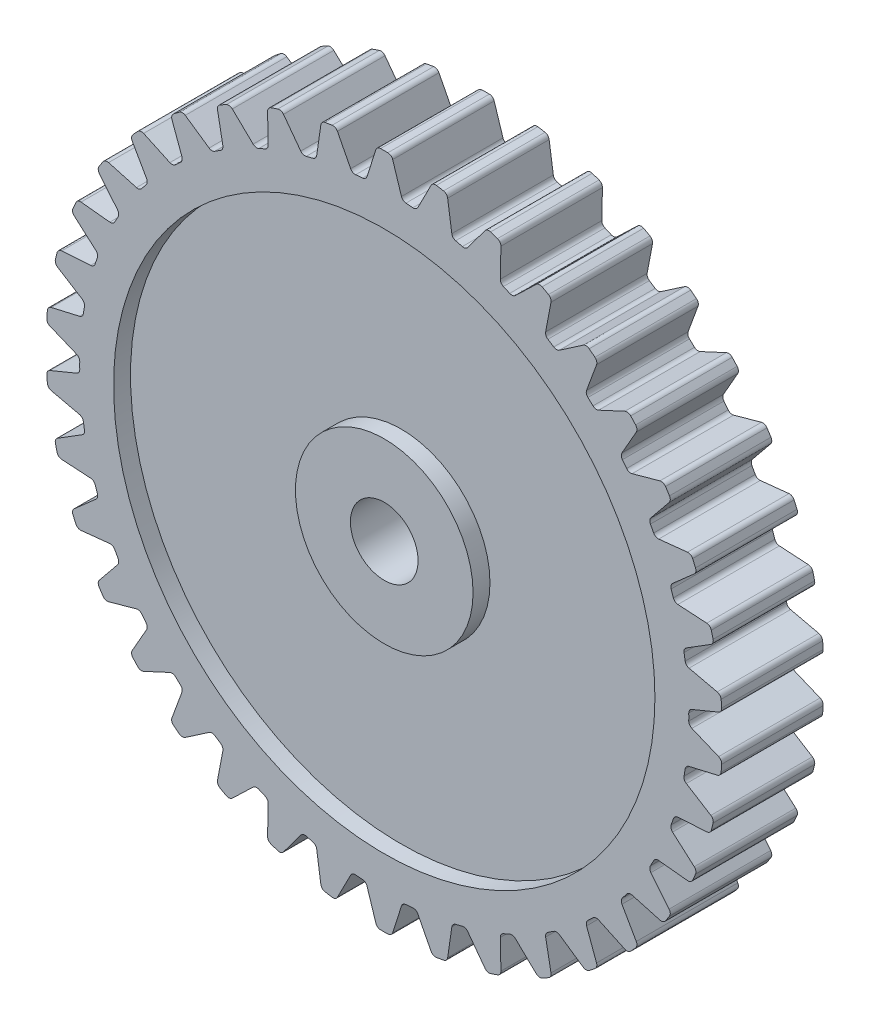
from build123d import *

# Parameters (mm, degrees)
SKETCH1_R           = 18
BODY_DEPTH          = 6
TOOTH_DEPTH         = 6
TOOTH_FILLET_R      = 0.3
TOOTH_START         = -6
TOOTH_PATTERN_DEPTH = 6
SKETCH3_R           = 16
SKETCH3_R_2         = 5.25
RESSES1_DEPTH       = 1
RESSES2_START       = -1
SKETCH4_R           = 16
SKETCH4_R_2         = 5.25
RESSES2_DEPTH       = 1
SKETCH5_R           = 5
BRASS_BOSS_DEPTH    = 5.7
SKETCH6_R           = 2
BORE_DEPTH          = 31.575410661
SKETCH7_R           = 1
GRUB_SCREW_DEPTH    = 31.575410661


# Read off the part's stored shape, not the designer's step: Tooth Pattern
with BuildPart() as part:
    # Sketch1 → Body (new body)
    with BuildSketch(Plane.XY):
        Circle(SKETCH1_R)
    extrude(amount=-BODY_DEPTH)

    # Sketch2 → Tooth (add)
    with BuildSketch(Plane.XY):
        with BuildLine():
            Line((-0.755, 18.984993416), (-1.080146971, 17.967561953))
            ThreePointArc((-1.080146971, 17.967561953), (0, 18), (1.080146971, 17.967561953))
            Line((1.080146971, 17.967561953), (0.755, 18.984993416))
            Line((0.755, 18.984993416), (0.432119981, 19.995331263))
            ThreePointArc((0.432119981, 19.995331263), (0, 20), (-0.432119981, 19.995331263))
            Line((-0.432119981, 19.995331263), (-0.755, 18.984993416))
        make_face()
    extrude(amount=-TOOTH_DEPTH)

    # Tooth Fillet
    tooth_fillet_edges = [part.edges().sort_by_distance(p)[0] for p in [
        (1.080146971, 17.967561953, -3),
        (-1.080146971, 17.967561953, -3),
        (-0.432119981, 19.995331263, -3),
        (0.432119981, 19.995331263, -3),
    ]]
    fillet(tooth_fillet_edges, radius=TOOTH_FILLET_R)

    # Tooth Pattern outline → Tooth Pattern (add)
    with BuildSketch(Plane.XY.offset(TOOTH_START)):
        with BuildLine():
            ThreePointArc((-2.766464282, 19.60218623), (-2.897226003, 19.73243964), (-3.079490328, 19.761496384))
            ThreePointArc((-3.079490328, 19.761496384), (-3.291891805, 19.727226068), (-3.503912338, 19.690672876))
            ThreePointArc((-3.503912338, 19.690672876), (-3.66686637, 19.604009378), (-3.748249848, 19.438355196))
            Line((-3.748249848, 19.438355196), (-3.993464858, 17.746921107))
            ThreePointArc((-3.993464858, 17.746921107), (-4.068630362, 17.587885563), (-4.220027265, 17.498324774))
            ThreePointArc((-4.220027265, 17.498324774), (-2.962702625, 17.754503462), (-1.690322218, 17.920457885))
            ThreePointArc((-1.690322218, 17.920457885), (-1.86259636, 17.956007529), (-1.985327947, 18.08201989))
            Line((-1.985327947, 18.08201989), (-2.766464282, 19.60218623))
        make_face()
        with BuildLine():
            ThreePointArc((1.690322218, 17.920457885), (2.962702625, 17.754503462), (4.220027265, 17.498324774))
            ThreePointArc((4.220027265, 17.498324774), (4.068630362, 17.587885563), (3.993464858, 17.746921107))
            Line((3.993464858, 17.746921107), (3.748249848, 19.438355196))
            ThreePointArc((3.748249848, 19.438355196), (3.66686637, 19.604009378), (3.503912338, 19.690672876))
            ThreePointArc((3.503912338, 19.690672876), (3.291891805, 19.727226068), (3.079490328, 19.761496384))
            ThreePointArc((3.079490328, 19.761496384), (2.897226003, 19.73243964), (2.766464282, 19.60218623))
            Line((2.766464282, 19.60218623), (1.985327947, 18.08201989))
            ThreePointArc((1.985327947, 18.08201989), (1.86259636, 17.956007529), (1.690322218, 17.920457885))
        make_face()
        with BuildLine():
            ThreePointArc((4.616878849, 17.397828304), (5.844590446, 17.024710351), (7.042601191, 16.565076772))
            ThreePointArc((7.042601191, 16.565076772), (6.908010365, 16.678335181), (6.860046411, 16.847573523))
            Line((6.860046411, 16.847573523), (6.896576715, 18.556299719))
            ThreePointArc((6.896576715, 18.556299719), (6.843568984, 18.733089874), (6.697101775, 18.845392748))
            ThreePointArc((6.697101775, 18.845392748), (6.493989384, 18.916344834), (6.290125495, 18.985107881))
            ThreePointArc((6.290125495, 18.985107881), (6.105564435, 18.986447156), (5.955147126, 18.879492905))
            Line((5.955147126, 18.879492905), (4.934453317, 17.508630467))
            ThreePointArc((4.934453317, 17.508630467), (4.792654676, 17.404537706), (4.616878849, 17.397828304))
        make_face()
        with BuildLine():
            ThreePointArc((7.417499061, 16.40063132), (8.567053075, 15.830527522), (9.673071314, 15.179976659))
            ThreePointArc((9.673071314, 15.179976659), (9.558957853, 15.313843292), (9.53950378, 15.488668051))
            Line((9.53950378, 15.488668051), (9.856782947, 17.168076758))
            ThreePointArc((9.856782947, 17.168076758), (9.833596875, 17.351180512), (9.707611734, 17.486059431))
            ThreePointArc((9.707611734, 17.486059431), (9.518947861, 17.589475024), (9.329182435, 17.690855126))
            ThreePointArc((9.329182435, 17.690855126), (9.147358984, 17.722553887), (8.98138908, 17.641816228))
            Line((8.98138908, 17.641816228), (7.748979663, 16.457651246))
            ThreePointArc((7.748979663, 16.457651246), (7.591981866, 16.378317464), (7.417499061, 16.40063132))
        make_face()
        with BuildLine():
            ThreePointArc((10.015789234, 14.956067866), (11.055828829, 14.204529169), (12.039685268, 13.380806353))
            ThreePointArc((12.039685268, 13.380806353), (11.949161889, 13.531629678), (11.958748354, 13.707272091))
            Line((11.958748354, 13.707272091), (12.548121835, 15.311553417))
            ThreePointArc((12.548121835, 15.311553417), (12.555389879, 15.495976177), (12.453323351, 15.649751996))
            ThreePointArc((12.453323351, 15.649751996), (12.284254254, 15.782810188), (12.113763597, 15.91404196))
            ThreePointArc((12.113763597, 15.91404196), (11.939637426, 15.975235548), (11.762642153, 15.922916793))
            Line((11.762642153, 15.922916793), (10.352134044, 14.957750202))
            ThreePointArc((10.352134044, 14.957750202), (10.184219581, 14.905339417), (10.015789234, 14.956067866))
        make_face()
        with BuildLine():
            ThreePointArc((12.340874786, 13.103541869), (13.243030392, 12.19106829), (14.077887993, 11.216642531))
            ThreePointArc((14.077887993, 11.216642531), (14.013423938, 11.380308481), (14.051789447, 11.55197748))
            Line((14.051789447, 11.55197748), (14.89718067, 13.037370814))
            ThreePointArc((14.89718067, 13.037370814), (14.934704575, 13.218082006), (14.85934077, 13.386560122))
            ThreePointArc((14.85934077, 13.386560122), (14.714478214, 13.545631432), (14.567912867, 13.703135214))
            ThreePointArc((14.567912867, 13.703135214), (14.406233684, 13.792154427), (14.223041012, 13.769681696))
            Line((14.223041012, 13.769681696), (12.672909195, 13.049840723))
            ThreePointArc((12.672909195, 13.049840723), (12.498658334, 13.025782565), (12.340874786, 13.103541869))
        make_face()
        with BuildLine():
            ThreePointArc((14.329333444, 10.893585408), (15.068996609, 9.845066847), (15.732082631, 8.746517941))
            ThreePointArc((15.732082631, 8.746517941), (15.695436313, 8.918562135), (15.761534355, 9.081575037))
            Line((15.761534355, 9.081575037), (16.83988325, 10.40756272))
            ThreePointArc((16.83988325, 10.40756272), (16.906639463, 10.579633016), (16.860034108, 10.758217784))
            ThreePointArc((16.860034108, 10.758217784), (16.743329565, 10.938963162), (16.62468745, 11.118442661))
            ThreePointArc((16.62468745, 11.118442661), (16.47986544, 11.232859286), (16.295472388, 11.240845578))
            Line((16.295472388, 11.240845578), (14.648000419, 10.785965608))
            ThreePointArc((14.648000419, 10.785965608), (14.47216627, 10.790916321), (14.329333444, 10.893585408))
        make_face()
        with BuildLine():
            ThreePointArc((15.92692524, 8.386480334), (16.48391988, 7.230517644), (16.957147066, 6.037811141))
            ThreePointArc((16.957147066, 6.037811141), (16.949318099, 6.213540663), (17.041345692, 6.363450901))
            Line((17.041345692, 6.363450901), (18.323237713, 7.493863446))
            ThreePointArc((18.323237713, 7.493863446), (18.417405298, 7.652599216), (18.400829666, 7.83641931))
            ThreePointArc((18.400829666, 7.83641931), (18.315466533, 8.033908493), (18.227983896, 8.230467976))
            ThreePointArc((18.227983896, 8.230467976), (18.103969427, 8.367161027), (17.923405756, 8.405388494))
            Line((17.923405756, 8.405388494), (16.223532375, 8.227877469))
            ThreePointArc((16.223532375, 8.227877469), (16.050911236, 8.26170201), (15.92692524, 8.386480334))
        make_face()
        with BuildLine():
            ThreePointArc((17.090072034, 5.650613939), (17.449204787, 4.418738768), (17.719664733, 3.164408593))
            ThreePointArc((17.719664733, 3.164408593), (17.740866672, 3.339029998), (17.856313542, 3.471748413))
            Line((17.856313542, 3.471748413), (19.306782017, 4.375751112))
            ThreePointArc((19.306782017, 4.375751112), (19.425792328, 4.516822458), (19.439698559, 4.700863745))
            ThreePointArc((19.439698559, 4.700863745), (19.388005319, 4.909709743), (19.334068458, 5.117987579))
            ThreePointArc((19.334068458, 5.117987579), (19.234244322, 5.273228426), (19.062435338, 5.340654324))
            Line((19.062435338, 5.340654324), (17.35652866, 5.44535428))
            ThreePointArc((17.35652866, 5.44535428), (17.191829184, 5.507130004), (17.090072034, 5.650613939))
        make_face()
        with BuildLine():
            ThreePointArc((17.787046213, 2.760613526), (17.938520874, 1.486428219), (17.998836138, 0.204689228))
            ThreePointArc((17.998836138, 0.204689228), (18.048490649, 0.3734393), (18.184207707, 0.485345678))
            Line((18.184207707, 0.485345678), (19.763687636, 1.138279695))
            ThreePointArc((19.763687636, 1.138279695), (19.904294382, 1.257838557), (19.94830315, 1.437080871))
            ThreePointArc((19.94830315, 1.437080871), (19.93168986, 1.65158691), (19.912770033, 1.865901823))
            ThreePointArc((19.912770033, 1.865901823), (19.839859172, 2.0354559), (19.681491377, 2.130241026))
            Line((19.681491377, 2.130241026), (18.016084088, 2.514296021))
            ThreePointArc((18.016084088, 2.514296021), (17.863798849, 2.602337848), (17.787046213, 2.760613526))
        make_face()
        with BuildLine():
            ThreePointArc((17.998836138, -0.204689228), (17.938520874, -1.486428219), (17.787046212, -2.760613526))
            ThreePointArc((17.787046212, -2.760613526), (17.863798849, -2.602337848), (18.016084088, -2.514296021))
            Line((18.016084088, -2.514296021), (19.681491377, -2.130241026))
            ThreePointArc((19.681491377, -2.130241026), (19.839859172, -2.0354559), (19.912770033, -1.865901823))
            ThreePointArc((19.912770033, -1.865901823), (19.93168986, -1.65158691), (19.94830315, -1.437080871))
            ThreePointArc((19.94830315, -1.437080871), (19.904294382, -1.257838557), (19.763687636, -1.138279695))
            Line((19.763687636, -1.138279695), (18.184207707, -0.485345678))
            ThreePointArc((18.184207707, -0.485345678), (18.048490649, -0.3734393), (17.998836138, -0.204689228))
        make_face()
        with BuildLine():
            ThreePointArc((17.719664733, -3.164408593), (17.449204787, -4.418738768), (17.090072034, -5.650613939))
            ThreePointArc((17.090072034, -5.650613939), (17.191829184, -5.507130004), (17.35652866, -5.44535428))
            Line((17.35652866, -5.44535428), (19.062435338, -5.340654324))
            ThreePointArc((19.062435338, -5.340654324), (19.234244322, -5.273228426), (19.334068458, -5.117987579))
            ThreePointArc((19.334068458, -5.117987579), (19.388005319, -4.909709743), (19.439698559, -4.700863745))
            ThreePointArc((19.439698559, -4.700863745), (19.425792328, -4.516822458), (19.306782017, -4.375751112))
            Line((19.306782017, -4.375751112), (17.856313542, -3.471748413))
            ThreePointArc((17.856313542, -3.471748413), (17.740866672, -3.339029998), (17.719664733, -3.164408593))
        make_face()
        with BuildLine():
            ThreePointArc((16.957147066, -6.037811141), (16.48391988, -7.230517644), (15.92692524, -8.386480334))
            ThreePointArc((15.92692524, -8.386480334), (16.050911236, -8.26170201), (16.223532375, -8.227877469))
            Line((16.223532375, -8.227877469), (17.923405756, -8.405388494))
            ThreePointArc((17.923405756, -8.405388494), (18.103969427, -8.367161027), (18.227983896, -8.230467976))
            ThreePointArc((18.227983896, -8.230467976), (18.315466533, -8.033908493), (18.400829666, -7.83641931))
            ThreePointArc((18.400829666, -7.83641931), (18.417405298, -7.652599216), (18.323237713, -7.493863446))
            Line((18.323237713, -7.493863446), (17.041345692, -6.363450901))
            ThreePointArc((17.041345692, -6.363450901), (16.949318099, -6.213540663), (16.957147066, -6.037811141))
        make_face()
        with BuildLine():
            ThreePointArc((15.732082631, -8.746517941), (15.068996609, -9.845066847), (14.329333444, -10.893585408))
            ThreePointArc((14.329333444, -10.893585408), (14.47216627, -10.790916321), (14.648000419, -10.785965608))
            Line((14.648000419, -10.785965608), (16.295472388, -11.240845578))
            ThreePointArc((16.295472388, -11.240845578), (16.47986544, -11.232859286), (16.62468745, -11.118442661))
            ThreePointArc((16.62468745, -11.118442661), (16.743329565, -10.938963162), (16.860034108, -10.758217784))
            ThreePointArc((16.860034108, -10.758217784), (16.906639463, -10.579633016), (16.83988325, -10.40756272))
            Line((16.83988325, -10.40756272), (15.761534355, -9.081575037))
            ThreePointArc((15.761534355, -9.081575037), (15.695436313, -8.918562135), (15.732082631, -8.746517941))
        make_face()
        with BuildLine():
            ThreePointArc((14.077887992, -11.216642531), (13.243030392, -12.191068289), (12.340874786, -13.103541869))
            ThreePointArc((12.340874786, -13.103541869), (12.498658334, -13.025782565), (12.672909195, -13.049840723))
            Line((12.672909195, -13.049840723), (14.223041012, -13.769681696))
            ThreePointArc((14.223041012, -13.769681696), (14.406233684, -13.792154427), (14.567912867, -13.703135214))
            ThreePointArc((14.567912867, -13.703135214), (14.714478214, -13.545631432), (14.85934077, -13.386560122))
            ThreePointArc((14.85934077, -13.386560122), (14.934704575, -13.218082006), (14.89718067, -13.037370814))
            Line((14.89718067, -13.037370814), (14.051789447, -11.55197748))
            ThreePointArc((14.051789447, -11.55197748), (14.013423938, -11.380308481), (14.077887992, -11.216642531))
        make_face()
        with BuildLine():
            ThreePointArc((12.039685268, -13.380806353), (11.055828829, -14.204529169), (10.015789234, -14.956067866))
            ThreePointArc((10.015789234, -14.956067866), (10.184219581, -14.905339417), (10.352134044, -14.957750202))
            Line((10.352134044, -14.957750202), (11.762642153, -15.922916793))
            ThreePointArc((11.762642153, -15.922916793), (11.939637426, -15.975235548), (12.113763597, -15.91404196))
            ThreePointArc((12.113763597, -15.91404196), (12.284254254, -15.782810188), (12.453323351, -15.649751996))
            ThreePointArc((12.453323351, -15.649751996), (12.555389879, -15.495976177), (12.548121835, -15.311553417))
            Line((12.548121835, -15.311553417), (11.958748354, -13.707272091))
            ThreePointArc((11.958748354, -13.707272091), (11.949161889, -13.531629678), (12.039685268, -13.380806353))
        make_face()
        with BuildLine():
            ThreePointArc((9.673071314, -15.179976659), (8.567053075, -15.830527522), (7.417499061, -16.40063132))
            ThreePointArc((7.417499061, -16.40063132), (7.591981866, -16.378317464), (7.748979663, -16.457651246))
            Line((7.748979663, -16.457651246), (8.98138908, -17.641816228))
            ThreePointArc((8.98138908, -17.641816228), (9.147358984, -17.722553887), (9.329182435, -17.690855126))
            ThreePointArc((9.329182435, -17.690855126), (9.518947861, -17.589475024), (9.707611734, -17.486059431))
            ThreePointArc((9.707611734, -17.486059431), (9.833596875, -17.351180512), (9.856782947, -17.168076758))
            Line((9.856782947, -17.168076758), (9.53950378, -15.488668051))
            ThreePointArc((9.53950378, -15.488668051), (9.558957853, -15.313843292), (9.673071314, -15.179976659))
        make_face()
        with BuildLine():
            ThreePointArc((7.042601191, -16.565076772), (5.844590446, -17.024710351), (4.616878849, -17.397828304))
            ThreePointArc((4.616878849, -17.397828304), (4.792654676, -17.404537706), (4.934453317, -17.508630467))
            Line((4.934453317, -17.508630467), (5.955147126, -18.879492905))
            ThreePointArc((5.955147126, -18.879492905), (6.105564435, -18.986447156), (6.290125495, -18.985107881))
            ThreePointArc((6.290125495, -18.985107881), (6.493989384, -18.916344834), (6.697101775, -18.845392748))
            ThreePointArc((6.697101775, -18.845392748), (6.843568984, -18.733089874), (6.896576715, -18.556299719))
            Line((6.896576715, -18.556299719), (6.860046411, -16.847573523))
            ThreePointArc((6.860046411, -16.847573523), (6.908010365, -16.678335181), (7.042601191, -16.565076772))
        make_face()
        with BuildLine():
            ThreePointArc((4.220027265, -17.498324774), (2.962702625, -17.754503461), (1.690322218, -17.920457885))
            ThreePointArc((1.690322218, -17.920457885), (1.86259636, -17.956007529), (1.985327947, -18.08201989))
            Line((1.985327947, -18.08201989), (2.766464282, -19.60218623))
            ThreePointArc((2.766464282, -19.60218623), (2.897226003, -19.73243964), (3.079490328, -19.761496384))
            ThreePointArc((3.079490328, -19.761496384), (3.291891805, -19.727226068), (3.503912338, -19.690672876))
            ThreePointArc((3.503912338, -19.690672876), (3.66686637, -19.604009378), (3.748249848, -19.438355196))
            Line((3.748249848, -19.438355196), (3.993464858, -17.746921107))
            ThreePointArc((3.993464858, -17.746921107), (4.068630362, -17.587885563), (4.220027265, -17.498324774))
        make_face()
        with BuildLine():
            ThreePointArc((1.282341997, -17.95426409), (0, -18), (-1.282341997, -17.95426409))
            ThreePointArc((-1.282341997, -17.95426409), (-1.118268729, -18.017684275), (-1.017951994, -18.162178947))
            Line((-1.017951994, -18.162178947), (-0.497680497, -19.790183015))
            ThreePointArc((-0.497680497, -19.790183015), (-0.390141201, -19.94018261), (-0.215145306, -19.998842779))
            ThreePointArc((-0.215145306, -19.998842779), (0, -20), (0.215145306, -19.998842779))
            ThreePointArc((0.215145306, -19.998842779), (0.390141201, -19.94018261), (0.497680497, -19.790183015))
            Line((0.497680497, -19.790183015), (1.017951994, -18.162178947))
            ThreePointArc((1.017951994, -18.162178947), (1.118268729, -18.017684275), (1.282341997, -17.95426409))
        make_face()
        with BuildLine():
            ThreePointArc((-1.690322218, -17.920457885), (-2.962702625, -17.754503461), (-4.220027265, -17.498324774))
            ThreePointArc((-4.220027265, -17.498324774), (-4.068630362, -17.587885563), (-3.993464858, -17.746921107))
            Line((-3.993464858, -17.746921107), (-3.748249848, -19.438355196))
            ThreePointArc((-3.748249848, -19.438355196), (-3.66686637, -19.604009378), (-3.503912338, -19.690672876))
            ThreePointArc((-3.503912338, -19.690672876), (-3.291891805, -19.727226068), (-3.079490328, -19.761496384))
            ThreePointArc((-3.079490328, -19.761496384), (-2.897226003, -19.73243964), (-2.766464282, -19.60218623))
            Line((-2.766464282, -19.60218623), (-1.985327947, -18.08201989))
            ThreePointArc((-1.985327947, -18.08201989), (-1.86259636, -17.956007529), (-1.690322218, -17.920457885))
        make_face()
        with BuildLine():
            ThreePointArc((-4.616878849, -17.397828304), (-5.844590446, -17.024710351), (-7.042601191, -16.565076772))
            ThreePointArc((-7.042601191, -16.565076772), (-6.908010365, -16.678335181), (-6.860046411, -16.847573523))
            Line((-6.860046411, -16.847573523), (-6.896576715, -18.556299719))
            ThreePointArc((-6.896576715, -18.556299719), (-6.843568984, -18.733089874), (-6.697101775, -18.845392748))
            ThreePointArc((-6.697101775, -18.845392748), (-6.493989384, -18.916344834), (-6.290125495, -18.985107881))
            ThreePointArc((-6.290125495, -18.985107881), (-6.105564435, -18.986447156), (-5.955147126, -18.879492905))
            Line((-5.955147126, -18.879492905), (-4.934453317, -17.508630467))
            ThreePointArc((-4.934453317, -17.508630467), (-4.792654676, -17.404537706), (-4.616878849, -17.397828304))
        make_face()
        with BuildLine():
            ThreePointArc((-7.417499061, -16.40063132), (-8.567053075, -15.830527522), (-9.673071314, -15.179976659))
            ThreePointArc((-9.673071314, -15.179976659), (-9.558957853, -15.313843292), (-9.53950378, -15.488668051))
            Line((-9.53950378, -15.488668051), (-9.856782947, -17.168076758))
            ThreePointArc((-9.856782947, -17.168076758), (-9.833596875, -17.351180512), (-9.707611734, -17.486059431))
            ThreePointArc((-9.707611734, -17.486059431), (-9.518947861, -17.589475024), (-9.329182435, -17.690855126))
            ThreePointArc((-9.329182435, -17.690855126), (-9.147358984, -17.722553887), (-8.98138908, -17.641816228))
            Line((-8.98138908, -17.641816228), (-7.748979663, -16.457651246))
            ThreePointArc((-7.748979663, -16.457651246), (-7.591981866, -16.378317464), (-7.417499061, -16.40063132))
        make_face()
        with BuildLine():
            ThreePointArc((-10.015789234, -14.956067866), (-11.055828829, -14.204529169), (-12.039685268, -13.380806353))
            ThreePointArc((-12.039685268, -13.380806353), (-11.949161889, -13.531629678), (-11.958748354, -13.707272091))
            Line((-11.958748354, -13.707272091), (-12.548121835, -15.311553417))
            ThreePointArc((-12.548121835, -15.311553417), (-12.555389879, -15.495976177), (-12.453323351, -15.649751996))
            ThreePointArc((-12.453323351, -15.649751996), (-12.284254254, -15.782810188), (-12.113763597, -15.91404196))
            ThreePointArc((-12.113763597, -15.91404196), (-11.939637426, -15.975235548), (-11.762642153, -15.922916793))
            Line((-11.762642153, -15.922916793), (-10.352134044, -14.957750202))
            ThreePointArc((-10.352134044, -14.957750202), (-10.184219581, -14.905339417), (-10.015789234, -14.956067866))
        make_face()
        with BuildLine():
            ThreePointArc((-12.340874786, -13.103541869), (-13.243030392, -12.191068289), (-14.077887992, -11.216642531))
            ThreePointArc((-14.077887992, -11.216642531), (-14.013423938, -11.380308481), (-14.051789447, -11.55197748))
            Line((-14.051789447, -11.55197748), (-14.89718067, -13.037370814))
            ThreePointArc((-14.89718067, -13.037370814), (-14.934704575, -13.218082006), (-14.85934077, -13.386560122))
            ThreePointArc((-14.85934077, -13.386560122), (-14.714478214, -13.545631432), (-14.567912867, -13.703135214))
            ThreePointArc((-14.567912867, -13.703135214), (-14.406233684, -13.792154427), (-14.223041012, -13.769681696))
            Line((-14.223041012, -13.769681696), (-12.672909195, -13.049840723))
            ThreePointArc((-12.672909195, -13.049840723), (-12.498658334, -13.025782565), (-12.340874786, -13.103541869))
        make_face()
        with BuildLine():
            ThreePointArc((-14.329333444, -10.893585408), (-15.068996609, -9.845066847), (-15.732082631, -8.746517941))
            ThreePointArc((-15.732082631, -8.746517941), (-15.695436313, -8.918562135), (-15.761534355, -9.081575037))
            Line((-15.761534355, -9.081575037), (-16.83988325, -10.40756272))
            ThreePointArc((-16.83988325, -10.40756272), (-16.906639463, -10.579633016), (-16.860034108, -10.758217784))
            ThreePointArc((-16.860034108, -10.758217784), (-16.743329565, -10.938963162), (-16.62468745, -11.118442661))
            ThreePointArc((-16.62468745, -11.118442661), (-16.47986544, -11.232859286), (-16.295472388, -11.240845578))
            Line((-16.295472388, -11.240845578), (-14.648000419, -10.785965608))
            ThreePointArc((-14.648000419, -10.785965608), (-14.47216627, -10.790916321), (-14.329333444, -10.893585408))
        make_face()
        with BuildLine():
            ThreePointArc((-15.92692524, -8.386480334), (-16.48391988, -7.230517644), (-16.957147066, -6.037811141))
            ThreePointArc((-16.957147066, -6.037811141), (-16.949318099, -6.213540663), (-17.041345692, -6.363450901))
            Line((-17.041345692, -6.363450901), (-18.323237713, -7.493863446))
            ThreePointArc((-18.323237713, -7.493863446), (-18.417405298, -7.652599216), (-18.400829666, -7.83641931))
            ThreePointArc((-18.400829666, -7.83641931), (-18.315466533, -8.033908493), (-18.227983896, -8.230467976))
            ThreePointArc((-18.227983896, -8.230467976), (-18.103969427, -8.367161027), (-17.923405756, -8.405388494))
            Line((-17.923405756, -8.405388494), (-16.223532375, -8.227877469))
            ThreePointArc((-16.223532375, -8.227877469), (-16.050911236, -8.26170201), (-15.92692524, -8.386480334))
        make_face()
        with BuildLine():
            ThreePointArc((-17.090072034, -5.650613939), (-17.449204787, -4.418738768), (-17.719664733, -3.164408593))
            ThreePointArc((-17.719664733, -3.164408593), (-17.740866672, -3.339029998), (-17.856313542, -3.471748413))
            Line((-17.856313542, -3.471748413), (-19.306782017, -4.375751112))
            ThreePointArc((-19.306782017, -4.375751112), (-19.425792328, -4.516822458), (-19.439698559, -4.700863745))
            ThreePointArc((-19.439698559, -4.700863745), (-19.388005319, -4.909709743), (-19.334068458, -5.117987579))
            ThreePointArc((-19.334068458, -5.117987579), (-19.234244322, -5.273228426), (-19.062435338, -5.340654324))
            Line((-19.062435338, -5.340654324), (-17.35652866, -5.44535428))
            ThreePointArc((-17.35652866, -5.44535428), (-17.191829184, -5.507130004), (-17.090072034, -5.650613939))
        make_face()
        with BuildLine():
            ThreePointArc((-17.787046212, -2.760613526), (-17.938520874, -1.486428219), (-17.998836138, -0.204689228))
            ThreePointArc((-17.998836138, -0.204689228), (-18.048490649, -0.3734393), (-18.184207707, -0.485345678))
            Line((-18.184207707, -0.485345678), (-19.763687636, -1.138279695))
            ThreePointArc((-19.763687636, -1.138279695), (-19.904294382, -1.257838557), (-19.94830315, -1.437080871))
            ThreePointArc((-19.94830315, -1.437080871), (-19.93168986, -1.65158691), (-19.912770033, -1.865901823))
            ThreePointArc((-19.912770033, -1.865901823), (-19.839859172, -2.0354559), (-19.681491377, -2.130241026))
            Line((-19.681491377, -2.130241026), (-18.016084088, -2.514296021))
            ThreePointArc((-18.016084088, -2.514296021), (-17.863798849, -2.602337848), (-17.787046212, -2.760613526))
        make_face()
        with BuildLine():
            ThreePointArc((-17.998836138, 0.204689228), (-17.938520874, 1.486428219), (-17.787046213, 2.760613526))
            ThreePointArc((-17.787046213, 2.760613526), (-17.863798849, 2.602337848), (-18.016084088, 2.514296021))
            Line((-18.016084088, 2.514296021), (-19.681491377, 2.130241026))
            ThreePointArc((-19.681491377, 2.130241026), (-19.839859172, 2.0354559), (-19.912770033, 1.865901823))
            ThreePointArc((-19.912770033, 1.865901823), (-19.93168986, 1.65158691), (-19.94830315, 1.437080871))
            ThreePointArc((-19.94830315, 1.437080871), (-19.904294382, 1.257838557), (-19.763687636, 1.138279695))
            Line((-19.763687636, 1.138279695), (-18.184207707, 0.485345678))
            ThreePointArc((-18.184207707, 0.485345678), (-18.048490649, 0.3734393), (-17.998836138, 0.204689228))
        make_face()
        with BuildLine():
            ThreePointArc((-17.719664733, 3.164408593), (-17.449204787, 4.418738768), (-17.090072034, 5.650613939))
            ThreePointArc((-17.090072034, 5.650613939), (-17.191829184, 5.507130004), (-17.35652866, 5.44535428))
            Line((-17.35652866, 5.44535428), (-19.062435338, 5.340654324))
            ThreePointArc((-19.062435338, 5.340654324), (-19.234244322, 5.273228426), (-19.334068458, 5.117987579))
            ThreePointArc((-19.334068458, 5.117987579), (-19.388005319, 4.909709743), (-19.439698559, 4.700863745))
            ThreePointArc((-19.439698559, 4.700863745), (-19.425792328, 4.516822458), (-19.306782017, 4.375751112))
            Line((-19.306782017, 4.375751112), (-17.856313542, 3.471748413))
            ThreePointArc((-17.856313542, 3.471748413), (-17.740866672, 3.339029998), (-17.719664733, 3.164408593))
        make_face()
        with BuildLine():
            ThreePointArc((-16.957147066, 6.037811141), (-16.48391988, 7.230517644), (-15.92692524, 8.386480334))
            ThreePointArc((-15.92692524, 8.386480334), (-16.050911236, 8.26170201), (-16.223532375, 8.227877469))
            Line((-16.223532375, 8.227877469), (-17.923405756, 8.405388494))
            ThreePointArc((-17.923405756, 8.405388494), (-18.103969427, 8.367161027), (-18.227983896, 8.230467976))
            ThreePointArc((-18.227983896, 8.230467976), (-18.315466533, 8.033908493), (-18.400829666, 7.83641931))
            ThreePointArc((-18.400829666, 7.83641931), (-18.417405298, 7.652599216), (-18.323237713, 7.493863446))
            Line((-18.323237713, 7.493863446), (-17.041345692, 6.363450901))
            ThreePointArc((-17.041345692, 6.363450901), (-16.949318099, 6.213540663), (-16.957147066, 6.037811141))
        make_face()
        with BuildLine():
            ThreePointArc((-15.732082631, 8.746517941), (-15.068996609, 9.845066847), (-14.329333444, 10.893585408))
            ThreePointArc((-14.329333444, 10.893585408), (-14.47216627, 10.790916321), (-14.648000419, 10.785965608))
            Line((-14.648000419, 10.785965608), (-16.295472388, 11.240845578))
            ThreePointArc((-16.295472388, 11.240845578), (-16.47986544, 11.232859286), (-16.62468745, 11.118442661))
            ThreePointArc((-16.62468745, 11.118442661), (-16.743329565, 10.938963162), (-16.860034108, 10.758217784))
            ThreePointArc((-16.860034108, 10.758217784), (-16.906639463, 10.579633016), (-16.83988325, 10.40756272))
            Line((-16.83988325, 10.40756272), (-15.761534355, 9.081575037))
            ThreePointArc((-15.761534355, 9.081575037), (-15.695436313, 8.918562135), (-15.732082631, 8.746517941))
        make_face()
        with BuildLine():
            ThreePointArc((-14.077887993, 11.216642531), (-13.243030392, 12.19106829), (-12.340874786, 13.103541869))
            ThreePointArc((-12.340874786, 13.103541869), (-12.498658334, 13.025782565), (-12.672909195, 13.049840723))
            Line((-12.672909195, 13.049840723), (-14.223041012, 13.769681696))
            ThreePointArc((-14.223041012, 13.769681696), (-14.406233684, 13.792154427), (-14.567912867, 13.703135214))
            ThreePointArc((-14.567912867, 13.703135214), (-14.714478214, 13.545631432), (-14.85934077, 13.386560122))
            ThreePointArc((-14.85934077, 13.386560122), (-14.934704575, 13.218082006), (-14.89718067, 13.037370814))
            Line((-14.89718067, 13.037370814), (-14.051789447, 11.55197748))
            ThreePointArc((-14.051789447, 11.55197748), (-14.013423938, 11.380308481), (-14.077887993, 11.216642531))
        make_face()
        with BuildLine():
            ThreePointArc((-12.039685268, 13.380806353), (-11.055828829, 14.204529169), (-10.015789234, 14.956067866))
            ThreePointArc((-10.015789234, 14.956067866), (-10.184219581, 14.905339417), (-10.352134044, 14.957750202))
            Line((-10.352134044, 14.957750202), (-11.762642153, 15.922916793))
            ThreePointArc((-11.762642153, 15.922916793), (-11.939637426, 15.975235548), (-12.113763597, 15.91404196))
            ThreePointArc((-12.113763597, 15.91404196), (-12.284254254, 15.782810188), (-12.453323351, 15.649751996))
            ThreePointArc((-12.453323351, 15.649751996), (-12.555389879, 15.495976177), (-12.548121835, 15.311553417))
            Line((-12.548121835, 15.311553417), (-11.958748354, 13.707272091))
            ThreePointArc((-11.958748354, 13.707272091), (-11.949161889, 13.531629678), (-12.039685268, 13.380806353))
        make_face()
        with BuildLine():
            ThreePointArc((-9.673071314, 15.179976659), (-8.567053075, 15.830527522), (-7.417499061, 16.40063132))
            ThreePointArc((-7.417499061, 16.40063132), (-7.591981866, 16.378317464), (-7.748979663, 16.457651246))
            Line((-7.748979663, 16.457651246), (-8.98138908, 17.641816228))
            ThreePointArc((-8.98138908, 17.641816228), (-9.147358984, 17.722553887), (-9.329182435, 17.690855126))
            ThreePointArc((-9.329182435, 17.690855126), (-9.518947861, 17.589475024), (-9.707611734, 17.486059431))
            ThreePointArc((-9.707611734, 17.486059431), (-9.833596875, 17.351180512), (-9.856782947, 17.168076758))
            Line((-9.856782947, 17.168076758), (-9.53950378, 15.488668051))
            ThreePointArc((-9.53950378, 15.488668051), (-9.558957853, 15.313843292), (-9.673071314, 15.179976659))
        make_face()
        with BuildLine():
            ThreePointArc((-7.042601191, 16.565076772), (-5.844590446, 17.024710351), (-4.616878849, 17.397828304))
            ThreePointArc((-4.616878849, 17.397828304), (-4.792654676, 17.404537706), (-4.934453317, 17.508630467))
            Line((-4.934453317, 17.508630467), (-5.955147126, 18.879492905))
            ThreePointArc((-5.955147126, 18.879492905), (-6.105564435, 18.986447156), (-6.290125495, 18.985107881))
            ThreePointArc((-6.290125495, 18.985107881), (-6.493989384, 18.916344834), (-6.697101775, 18.845392748))
            ThreePointArc((-6.697101775, 18.845392748), (-6.843568984, 18.733089874), (-6.896576715, 18.556299719))
            Line((-6.896576715, 18.556299719), (-6.860046411, 16.847573523))
            ThreePointArc((-6.860046411, 16.847573523), (-6.908010365, 16.678335181), (-7.042601191, 16.565076772))
        make_face()
    extrude(amount=TOOTH_PATTERN_DEPTH)

    # Sketch3 → Resses1 (cut)
    with BuildSketch(Plane.XY):
        Circle(SKETCH3_R)
        Circle(SKETCH3_R_2, mode=Mode.SUBTRACT)
    extrude(amount=-RESSES1_DEPTH, mode=Mode.SUBTRACT)

    # Sketch4 → Resses2 (cut)
    with BuildSketch(Plane(origin=(0, 0, -6), x_dir=(-1, 0, 0), z_dir=(0, 0, -1)).offset(RESSES2_START)):
        with Locations(Location((0, 0, 0), (0, 0, 180))):
            Circle(SKETCH4_R)
        with Locations(Location((0, 0, 0), (0, 0, 180))):
            Circle(SKETCH4_R_2, mode=Mode.SUBTRACT)
    extrude(amount=RESSES2_DEPTH, mode=Mode.SUBTRACT)

    # Sketch5 → Brass boss (add)
    with BuildSketch(Plane(origin=(0, 0, -6), x_dir=(-1, 0, 0), z_dir=(0, 0, -1))):
        with Locations(Location((0, 0, 0), (0, 0, 180))):
            Circle(SKETCH5_R)
    extrude(amount=BRASS_BOSS_DEPTH)

    # Sketch6 → Bore (cut, through all)
    with BuildSketch(Plane(origin=(0, 0, -11.7), x_dir=(-1, 0, 0), z_dir=(0, 0, -1))):
        Circle(SKETCH6_R)
    extrude(amount=-BORE_DEPTH, mode=Mode.SUBTRACT)

    # Sketch7 → Grub screw (cut, through all)
    with BuildSketch(Plane(origin=(0, 0, 0), x_dir=(1, 0, 0), z_dir=(0, 1, 0))):
        with Locations(Location((0, 8.862584309, 0), (0, 0, 270))):
            Circle(SKETCH7_R)
    extrude(amount=-GRUB_SCREW_DEPTH, mode=Mode.SUBTRACT)


solid = part.part
